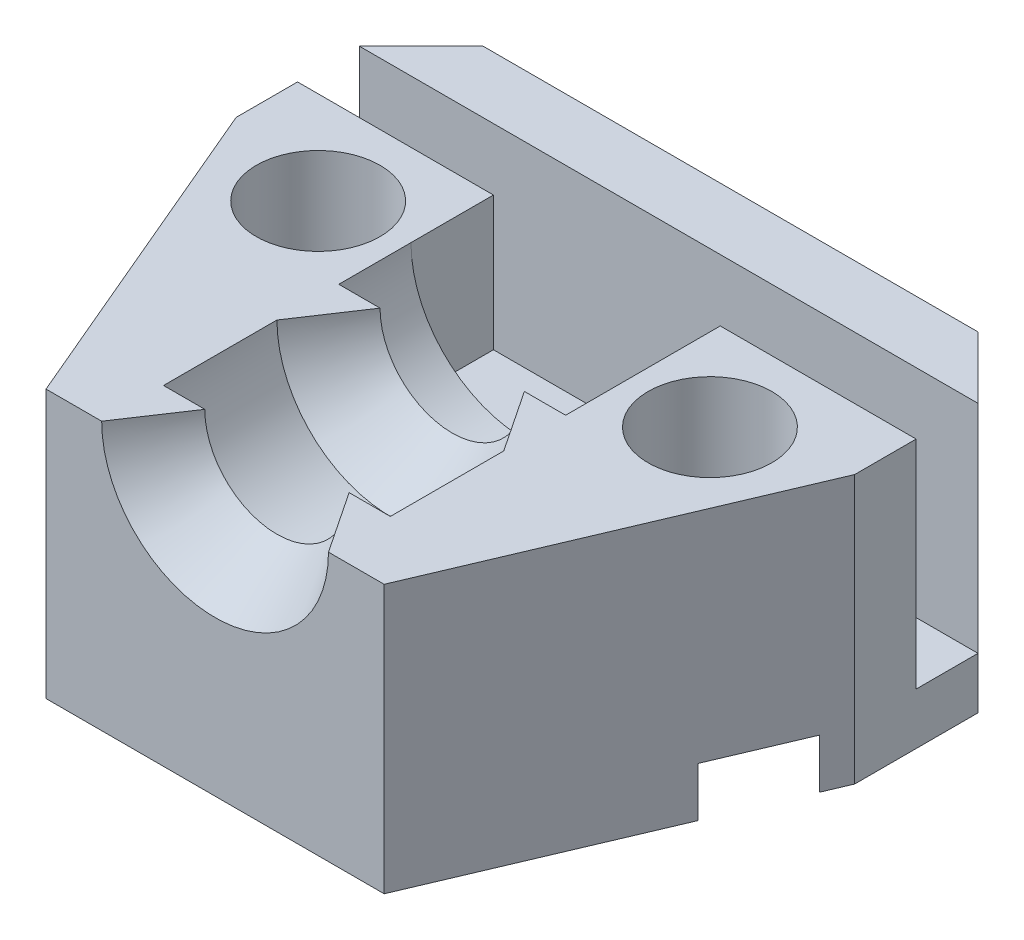
from build123d import *

# Parameters (mm, degrees)
SKETCH1_W           = 15
SKETCH1_H           = 12.5
BOSS_EXTRUDE1_DEPTH = 6.5
SKETCH2_R           = 1.5
CUT_EXTRUDE1_DEPTH  = 12.728704106
CHAMFER1_SIZE       = 3.4
CHAMFER1_SIZE2      = 8.009898044
SKETCH2_3_R         = 2.5
SKETCH2_3_R_2       = 1.5
CUT_EXTRUDE5_DEPTH  = 1.2
CUT_EXTRUDE4_DEPTH  = 5.25
SKETCH3_W           = 5.5
SKETCH3_H           = 2
CUT_EXTRUDE3_DEPTH  = 3.25
CHAMFER2_SIZE       = 1.5


with BuildPart() as part:
    # Sketch1 → Boss-Extrude1 (new body)
    with BuildSketch(Plane(origin=(0, 0, 0), x_dir=(1, 0, 0), z_dir=(0, 1, 0))):
        Rectangle(SKETCH1_W, SKETCH1_H)
    extrude(amount=BOSS_EXTRUDE1_DEPTH)

    # Sketch2 → Cut-Extrude1 (cut, through all)
    with BuildSketch(Plane(origin=(0, 0, 0), x_dir=(1, 0, 0), z_dir=(0, 1, 0))):
        with Locations(Location((4.75, 1, 0), (0, 0, 90))):
            Circle(SKETCH2_R)
        with Locations(Location((-4.75, 1, 0), (0, 0, 90))):
            Circle(SKETCH2_R)
    extrude(amount=CUT_EXTRUDE1_DEPTH, mode=Mode.SUBTRACT)

    # Chamfer1
    chamfer1_edges = [part.edges().sort_by_distance(p)[0] for p in [
        (7.5, 3.25, 6.25),
        (-7.5, 3.25, 6.25),
    ]]
    chamfer1_side = [part.faces().sort_by_distance(p)[0] for p in [
        (0, 3.25, 6.25),
    ]]
    chamfer(chamfer1_edges, length=CHAMFER1_SIZE, length2=CHAMFER1_SIZE2, reference=chamfer1_side[0])

    # Sketch2<3> → Cut-Extrude5 (cut)
    # profile 1 of 2: a face of its own
    with BuildSketch(Plane(origin=(0, 0, 0), x_dir=(1, 0, 0), z_dir=(0, 1, 0))):
        with Locations((4.75, 1)):
            Circle(SKETCH2_3_R)
        with Locations(Location((4.75, 1, 0), (0, 0, 90))):
            Circle(SKETCH2_3_R_2, mode=Mode.SUBTRACT)
    # profile 2 of 2: a face of its own
    with BuildSketch(Plane(origin=(0, 0, 0), x_dir=(1, 0, 0), z_dir=(0, 1, 0))):
        with Locations((-4.75, 1)):
            Circle(SKETCH2_3_R)
        with Locations(Location((-4.75, 1, 0), (0, 0, 90))):
            Circle(SKETCH2_3_R_2, mode=Mode.SUBTRACT)
    extrude(amount=CUT_EXTRUDE5_DEPTH, mode=Mode.SUBTRACT)

    # Sketch3<3> → Cut-Extrude4 (cut)
    with BuildSketch(Plane(origin=(0, 6.5, 0), x_dir=(1, 0, 0), z_dir=(0, 1, 0))):
        Polygon((7.5, 4.75), (-7.5, 4.75), (-7.5, 3.25), (-2.75, 3.25), (2.75, 3.25), (7.5, 3.25), align=None)
    extrude(amount=-CUT_EXTRUDE4_DEPTH, mode=Mode.SUBTRACT)

    # Sketch4 → Cut-Revolve1 (revolve, cut)
    with BuildSketch(Plane(origin=(0, 6.5, 0), x_dir=(1, 0, 0), z_dir=(0, 1, 0))):
        Polygon((2.75, 1.25), (2.75, -0.5), (1.75, -0.5), (2.75, -2), (2.75, -4.75), (1.75, -4.75), (2.75, -6.25), (0, -6.25), (0, 1.25), align=None)
    revolve(axis=Axis((0, 6.5, 6.25), (0, 0, -1)), mode=Mode.SUBTRACT)

    # Sketch3 → Cut-Extrude3 (cut)
    with BuildSketch(Plane(origin=(0, 6.5, 0), x_dir=(1, 0, 0), z_dir=(0, 1, 0))):
        with Locations((0, 2.25)):
            Rectangle(SKETCH3_W, SKETCH3_H)
    extrude(amount=-CUT_EXTRUDE3_DEPTH, mode=Mode.SUBTRACT)

    # Chamfer2
    chamfer2_edges = [part.edges().sort_by_distance(p)[0] for p in [
        (-7.5, 3.25, -6.25),
        (7.5, 3.25, -6.25),
    ]]
    chamfer(chamfer2_edges, length=CHAMFER2_SIZE - 0.0001)  # a hair under: the kernel refuses the full size


solid = part.part
